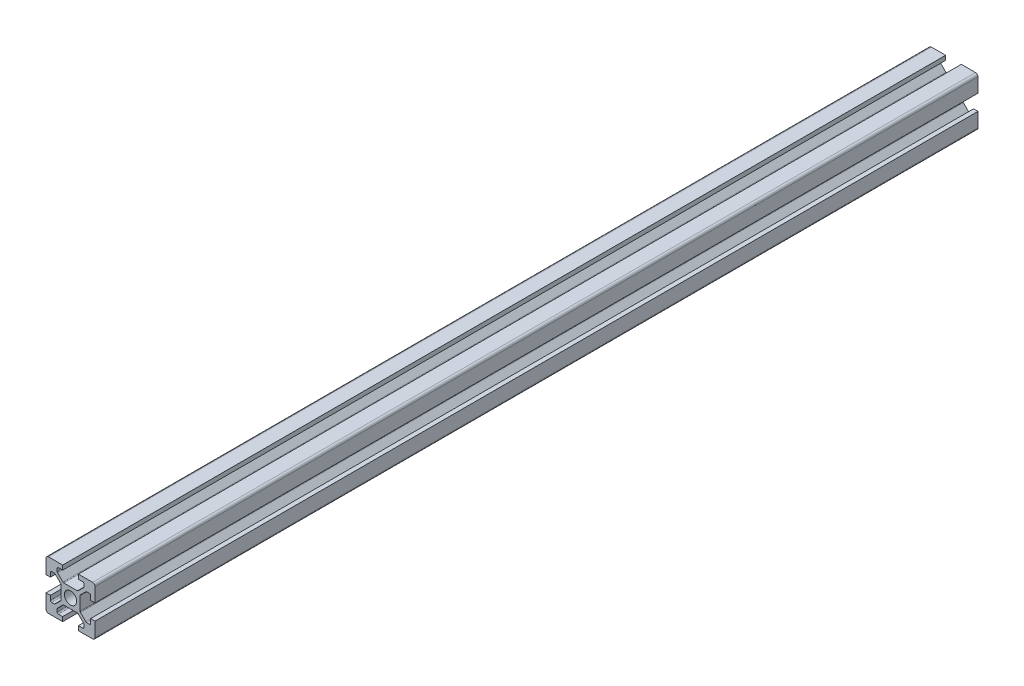
from build123d import *

# Parameters (mm, degrees)
SKETCH1_R           = 2.5
BOSS_EXTRUDE1_DEPTH = 360
FILLET1_R           = 1
FILLET2_R           = 0.5
FILLET3_R           = 0.5
FILLET4_R           = 0.5
FILLET5_R           = 0.5


with BuildPart() as part:
    # Sketch1 → Boss-Extrude1 (new body)
    with BuildSketch(Plane.XY):
        Polygon((0, 6.8), (0, 0), (6.8, 0), (6.8, 1.8), (4.55, 1.8), (4.55, 3.6), (7.05, 6.1), (12.95, 6.1), (15.45, 3.6), (15.45, 1.8), (13.2, 1.8), (13.2, 0), (20, 0), (20, 6.8), (18.2, 6.8), (18.2, 4.55), (16.4, 4.55), (13.9, 7.05), (13.9, 12.95), (16.4, 15.45), (18.2, 15.45), (18.2, 13.2), (20, 13.2), (20, 20), (13.2, 20), (13.2, 18.2), (15.45, 18.2), (15.45, 16.4), (12.95, 13.9), (7.05, 13.9), (4.55, 16.4), (4.55, 18.2), (6.8, 18.2), (6.8, 20), (0, 20), (0, 13.2), (1.8, 13.2), (1.8, 15.45), (3.6, 15.45), (6.1, 12.95), (6.1, 7.05), (3.6, 4.55), (1.8, 4.55), (1.8, 6.8), align=None)
        with Locations((10, 10)):
            Circle(SKETCH1_R, mode=Mode.SUBTRACT)
    extrude(amount=BOSS_EXTRUDE1_DEPTH)

    # Fillet1
    fillet1_edges = [part.edges().sort_by_distance(p)[0] for p in [
        (20, 20, 180),
        (20, 0, 180),
        (0, 0, 180),
        (0, 20, 180),
    ]]
    fillet(fillet1_edges, radius=FILLET1_R)

    # Fillet2
    fillet2_edges = [part.edges().sort_by_distance(p)[0] for p in [
        (4.55, 18.2, 180),
        (4.55, 16.4, 180),
        (7.05, 13.9, 180),
        (15.45, 18.2, 180),
        (15.45, 16.4, 180),
        (12.95, 13.9, 180),
    ]]
    fillet(fillet2_edges, radius=FILLET2_R)

    # Fillet3
    fillet3_edges = [part.edges().sort_by_distance(p)[0] for p in [
        (18.2, 15.45, 180),
        (16.4, 15.45, 180),
        (13.9, 12.95, 180),
        (18.2, 4.55, 180),
        (13.9, 7.05, 180),
        (16.4, 4.55, 180),
    ]]
    fillet(fillet3_edges, radius=FILLET3_R)

    # Fillet4
    fillet4_edges = [part.edges().sort_by_distance(p)[0] for p in [
        (1.8, 15.45, 180),
        (3.6, 15.45, 180),
        (6.1, 12.95, 180),
        (3.6, 4.55, 180),
        (1.8, 4.55, 180),
        (6.1, 7.05, 180),
    ]]
    fillet(fillet4_edges, radius=FILLET4_R)

    # Fillet5
    fillet5_edges = [part.edges().sort_by_distance(p)[0] for p in [
        (7.05, 6.1, 180),
        (4.55, 3.6, 180),
        (4.55, 1.8, 180),
        (15.45, 1.8, 180),
        (15.45, 3.6, 180),
        (12.95, 6.1, 180),
    ]]
    fillet(fillet5_edges, radius=FILLET5_R)


solid = part.part
